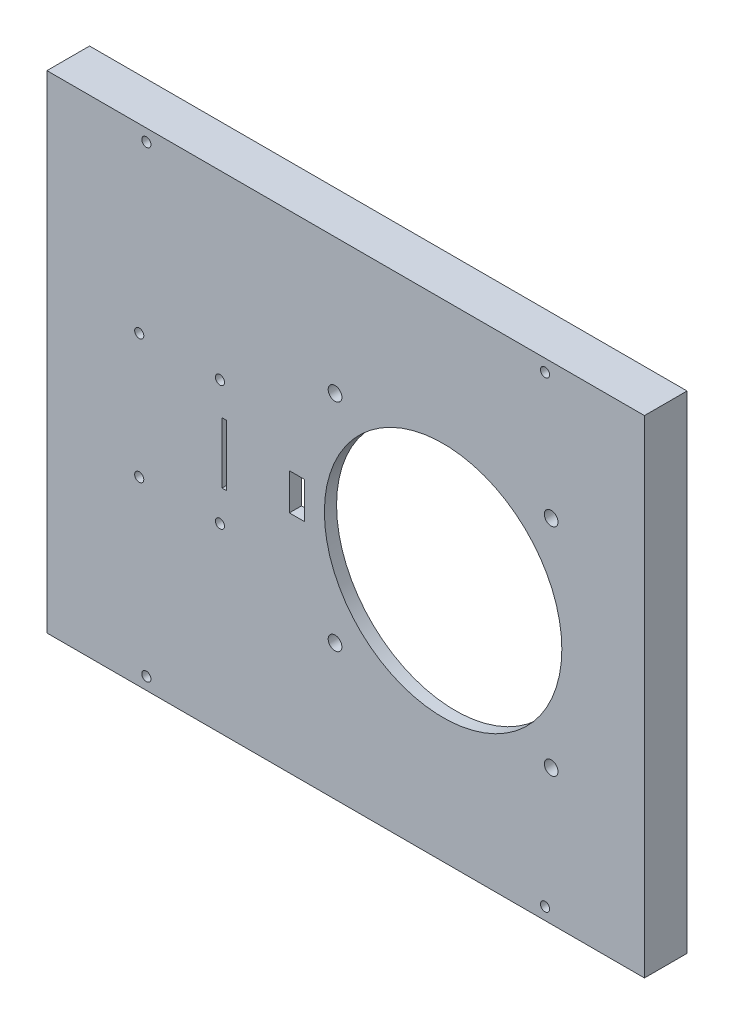
from build123d import *

# Parameters (mm, degrees)
SCHIZZO1_W                   = 196.27671429
SCHIZZO1_H                   = 160
SCHIZZO1_W_2                 = 160
SCHIZZO1_H_2                 = 146
ESTRUSIONE_ESTRUSIONE1_DEPTH = 10
SCHIZZO2_W                   = 196.27671429
SCHIZZO2_H                   = 160
ESTRUSIONE_ESTRUSIONE2_DEPTH = 4
SCHIZZO3_R                   = 1.5
TAGLIO_ESTRUSIONE1_DEPTH     = 93
SCHIZZO4_R                   = 39
SCHIZZO4_R_2                 = 2.25
SCHIZZO4_R_3                 = 1.5
SCHIZZO4_W                   = 5
SCHIZZO4_H                   = 12
SCHIZZO4_W_2                 = 1.5
SCHIZZO4_H_2                 = 20
TAGLIO_ESTRUSIONE2_DEPTH     = 90


with BuildPart() as part:
    # Schizzo1 → Estrusione-Estrusione1 (new body)
    with BuildSketch(Plane.XY):
        Rectangle(SCHIZZO1_W, SCHIZZO1_H)
        Rectangle(SCHIZZO1_W_2, SCHIZZO1_H_2, mode=Mode.SUBTRACT)
    extrude(amount=ESTRUSIONE_ESTRUSIONE1_DEPTH)

    # Schizzo2 → Estrusione-Estrusione2 (add)
    with BuildSketch(Plane.XY.offset(10)):
        Rectangle(SCHIZZO2_W, SCHIZZO2_H)
    extrude(amount=ESTRUSIONE_ESTRUSIONE2_DEPTH)

    # Schizzo3 → Taglio-Estrusione1 (cut)
    with BuildSketch(Plane(origin=(0, 0, 0), x_dir=(-1, 0, 0), z_dir=(0, 0, -1))):
        with Locations((65.48331215, 76)):
            Circle(SCHIZZO3_R)
        with Locations((-65.48331215, 76)):
            Circle(SCHIZZO3_R)
        with Locations((-65.48331215, -76)):
            Circle(SCHIZZO3_R)
        with Locations((65.48331215, -76)):
            Circle(SCHIZZO3_R)
    extrude(amount=-TAGLIO_ESTRUSIONE1_DEPTH, mode=Mode.SUBTRACT)

    # Schizzo4 → Taglio-Estrusione2 (cut)
    with BuildSketch(Plane(origin=(0, 0, 10), x_dir=(-1, 0, 0), z_dir=(0, 0, -1))):
        with Locations((-32, 0)):
            Circle(SCHIZZO4_R)
        with Locations((3.499999997, 35.499999997)):
            Circle(SCHIZZO4_R_2)
        with Locations((3.499999997, -35.499999997)):
            Circle(SCHIZZO4_R_2)
        with Locations((-67.499999997, 35.499999997)):
            Circle(SCHIZZO4_R_2)
        with Locations((-67.499999997, -35.499999997)):
            Circle(SCHIZZO4_R_2)
        with Locations((41.299094201, 20.449190864)):
            Circle(SCHIZZO4_R_3)
        with Locations((41.299094201, -20.449190864)):
            Circle(SCHIZZO4_R_3)
        with Locations((67.823483409, -20.449190864)):
            Circle(SCHIZZO4_R_3)
        with Locations((67.823483409, 20.449190864)):
            Circle(SCHIZZO4_R_3)
        with Locations((16, 0)):
            Rectangle(SCHIZZO4_W, SCHIZZO4_H)
        with Locations((39.87257761, 0)):
            Rectangle(SCHIZZO4_W_2, SCHIZZO4_H_2)
    extrude(amount=-TAGLIO_ESTRUSIONE2_DEPTH, mode=Mode.SUBTRACT)


solid = part.part
